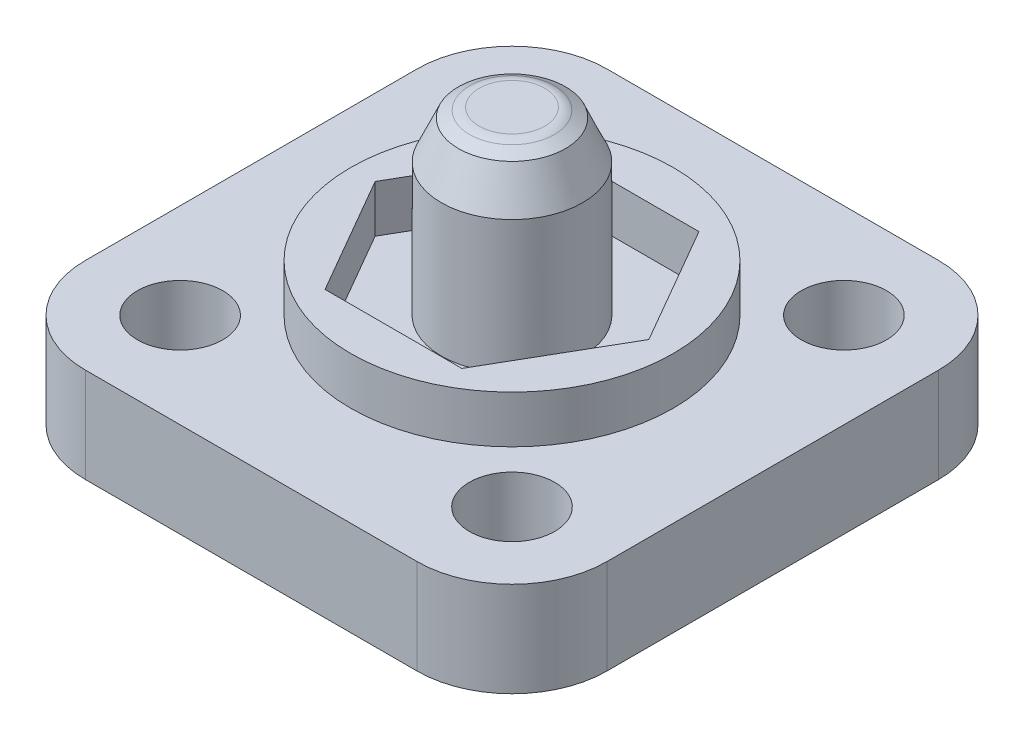
from build123d import *

# Parameters (mm, degrees)
BOSS_EXTRUDE1_DEPTH                        = 10
SKETCH3_R                                  = 4.5
CUT_EXTRUDE1_DEPTH                         = 44.283946216
MIRROR1_AT_THE_SECOND_PLANE_COPY_1_SKETC_R = 4.5
MIRROR1_AT_THE_SECOND_PLANE_COPY_1_DEPTH   = 44.283946216
CUT_EXTRUDE3_START                         = -5
SKETCH4_R                                  = 7.45
CUT_EXTRUDE3_DEPTH                         = 5
CHAMFER1_SIZE                              = 3
CHAMFER1_SIZE2                             = 2.081012683


with BuildPart() as part:
    # Sketch1 → Revolve1 (revolve)
    with BuildSketch(Plane.XY):
        with BuildLine():
            Line((0, 9.5), (3.462206124, 9.5))
            ThreePointArc((3.462206124, 9.5), (3.981551863, 9.43139328), (4.465266995, 9.230280003))
            Line((4.465266995, 9.230280003), (7.45, 7.5))
            Line((7.45, 7.5), (7.45, -4.5))
            Line((7.45, -4.5), (17, -4.5))
            Line((17, -4.5), (17, -9.5))
            Line((17, -9.5), (7.45, -9.5))
            Line((7.45, -9.5), (0, -9.5))
            Line((0, -9.5), (0, 9.5))
        make_face()
    revolve(axis=Axis((0, 9.5, 0), (0, -1, 0)))

    # Sketch2 → Boss-Extrude1 (add)
    with BuildSketch(Plane.XZ.offset(9.5)):
        with BuildLine():
            Line((17.5, 27.5), (-17.5, 27.5))
            ThreePointArc((-17.5, 27.5), (-24.571067812, 24.571067812), (-27.5, 17.5))
            Line((-27.5, 17.5), (-27.5, -17.5))
            ThreePointArc((-27.5, -17.5), (-24.571067812, -24.571067812), (-17.5, -27.5))
            Line((-17.5, -27.5), (17.5, -27.5))
            ThreePointArc((17.5, -27.5), (24.571067812, -24.571067812), (27.5, -17.5))
            Line((27.5, -17.5), (27.5, 17.5))
            ThreePointArc((27.5, 17.5), (24.571067812, 24.571067812), (17.5, 27.5))
        make_face()
    extrude(amount=BOSS_EXTRUDE1_DEPTH)

    # Sketch3 → Cut-Extrude1 (cut, through all)
    with BuildSketch(Plane(origin=(0, -9.5, 0), x_dir=(1, 0, 0), z_dir=(0, 1, 0))):
        with Locations((-17.5, 17.5)):
            Circle(SKETCH3_R)
    cut_extrude1 = extrude(amount=-CUT_EXTRUDE1_DEPTH, mode=Mode.SUBTRACT)

    # Mirror1: Cut-Extrude1 across plane
    add(cut_extrude1.mirror(Plane.XY), mode=Mode.SUBTRACT)

    # Mirror1 at the second plane: Cut-Extrude1 across plane
    add(cut_extrude1.mirror(Plane(origin=(0, 0, 0), x_dir=(0, 0, 1), z_dir=(1, 0, 0))), mode=Mode.SUBTRACT)

    # Mirror1 at the second plane copy 1 sketc → Mirror1 at the second plane copy 1 (cut, through all)
    with BuildSketch(Plane(origin=(0, -9.5, 0), x_dir=(-1, 0, 0), z_dir=(0, 1, 0))):
        with Locations((-17.5, 17.5)):
            Circle(MIRROR1_AT_THE_SECOND_PLANE_COPY_1_SKETC_R)
    extrude(amount=-MIRROR1_AT_THE_SECOND_PLANE_COPY_1_DEPTH, mode=Mode.SUBTRACT)

    # Sketch4 → Cut-Extrude3 (cut)
    with BuildSketch(Plane(origin=(0, -4.5, 0), x_dir=(1, 0, 0), z_dir=(0, 1, 0)).offset(CUT_EXTRUDE3_START)):
        Polygon((14.43375673, 0), (7.216878365, 12.5), (-7.216878365, 12.5), (-14.43375673, 0), (-7.216878365, -12.5), (7.216878365, -12.5), align=None)
        Circle(SKETCH4_R, mode=Mode.SUBTRACT)
    extrude(amount=CUT_EXTRUDE3_DEPTH, mode=Mode.SUBTRACT)

    # Chamfer1
    chamfer1_edges = [part.edges().sort_by_distance(p)[0] for p in [
        (-7.45, 7.5, 0),
    ]]
    chamfer1_side = [part.faces().sort_by_distance(p)[0] for p in [
        (-7.45, 1.5, 0),
    ]]
    chamfer(chamfer1_edges, length=CHAMFER1_SIZE, length2=CHAMFER1_SIZE2, reference=chamfer1_side[0])


solid = part.part
